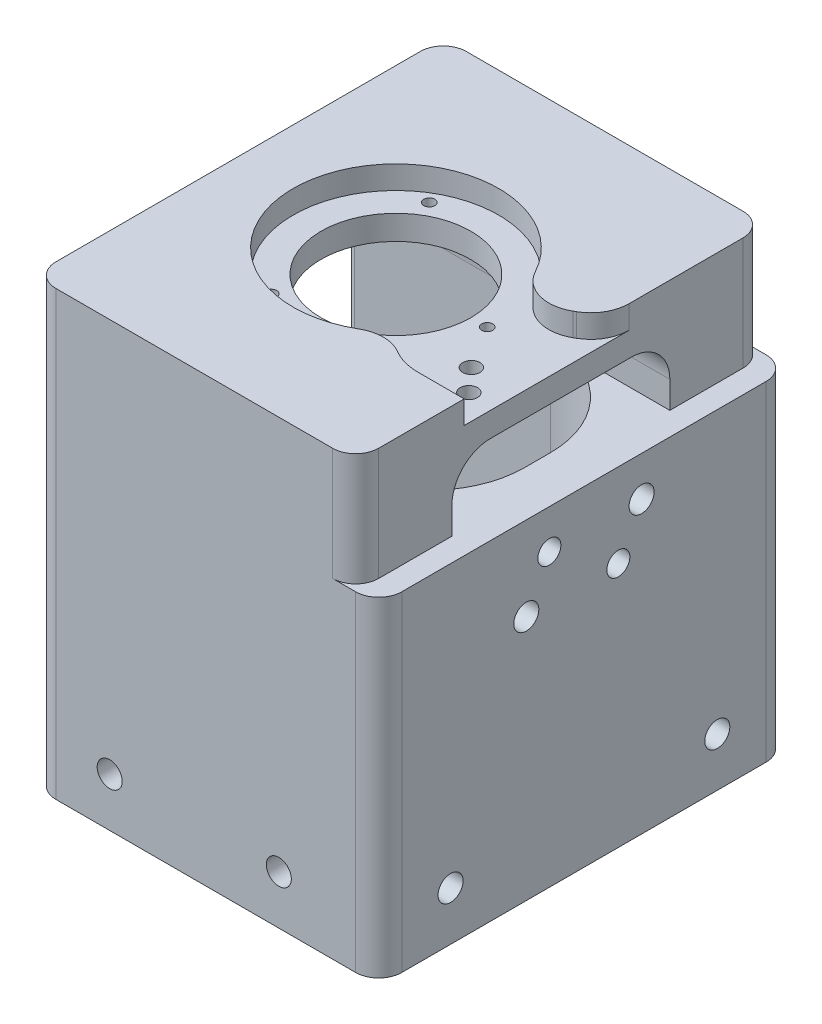
from build123d import *

# Parameters (mm, degrees)
SKETCH1_W                = 90
SKETCH1_H                = 83.75
BOSS_EXTRUDE1_DEPTH      = 106.8
BOSS_EXTRUDE2_DEPTH      = 25.4
CUT_EXTRUDE1_DEPTH       = 163.850552655
CUT_EXTRUDE1_DEPTH_BACK  = 163.850552655
SKETCH3_R                = 3.25755
CUT_EXTRUDE2_DEPTH       = 163.850552655
CUT_EXTRUDE2_DEPTH_BACK  = 163.850552655
SKETCH4_R                = 3.25755
SKETCH5_W                = 56.7
SKETCH5_H                = 77.4
CUT_EXTRUDE3_DEPTH       = 84
FILLET3_R                = 10
CUT_EXTRUDE4_DEPTH       = 178.256769969
CUT_EXTRUDE4_DEPTH_BACK  = 178.256769969
SKETCH6_R                = 1.45
SKETCH6_R_2              = 19.5
CUT_EXTRUDE5_DEPTH       = 163.850552762
CUT_EXTRUDE5_DEPTH_BACK  = 6
SKETCH8_W                = 84
SKETCH8_H                = 106.8
SKETCH8_R                = 26.75
BOSS_EXTRUDE3_DEPTH      = 6
SKETCH9_R                = 2.5
CUT_EXTRUDE6_DEPTH       = 174.418799442
SKETCH10_R               = 3
SKETCH10_R_2             = 3.25755
CUT_EXTRUDE7_DEPTH       = 167.015970671
SKETCH11_W               = 56.7
SKETCH11_H               = 60.4
SKETCH11_R               = 3.25755
SKETCH11_R_2             = 3
BOSS_EXTRUDE4_DEPTH      = 6
FILLET5_R                = 25
SKETCH12_R               = 7
SKETCH12_R_2             = 3.25755
CUT_EXTRUDE8_DEPTH       = 160.828978961
SKETCH13_R               = 2.25
CUT_EXTRUDE9_DEPTH       = 12.35
SKETCH14_R               = 2.25
CUT_EXTRUDE10_DEPTH      = 6
FILLET6_R                = 10
FILLET2_R                = 6
CUT_EXTRUDE11_DEPTH      = 17
CUT_EXTRUDE11_DEPTH_BACK = 3
SKETCH15_R               = 2.25
FILLET8_R                = 2


# Some blends are built 0.0001 mm under size
with BuildPart() as part:
    # Sketch1 → Boss-Extrude1 (new body)
    with BuildSketch(Plane.XY):
        with Locations((45, 41.875)):
            Rectangle(SKETCH1_W, SKETCH1_H)
    extrude(amount=BOSS_EXTRUDE1_DEPTH)

    # Sketch2 → Boss-Extrude2 (add)
    with BuildSketch(Plane.XZ):
        Polygon((0, 106.8), (90, 106.8), (90, 0), (0, 0), (0, 6), (84, 6), (84, 100.8), (0, 100.8), align=None)
    extrude(amount=BOSS_EXTRUDE2_DEPTH)

    # Sketch3 → Cut-Extrude1 (cut, two sides: drawn at the far end of the back side and taken through both)
    with BuildSketch(Plane(origin=(90, 0, 0), x_dir=(0, 0, -1), z_dir=(1, 0, 0)).offset(-CUT_EXTRUDE1_DEPTH_BACK)):
        with Locations((-88.1, -12.7)):
            Circle(SKETCH3_R)
        with Locations((-18.7, -12.7)):
            Circle(SKETCH3_R)
    extrude(amount=CUT_EXTRUDE1_DEPTH + CUT_EXTRUDE1_DEPTH_BACK, mode=Mode.SUBTRACT)

    # Sketch4 → Cut-Extrude2 (cut, two sides: drawn at the far end of the back side and taken through both)
    with BuildSketch(Plane(origin=(0, 0, 0), x_dir=(-1, 0, 0), z_dir=(0, 0, -1)).offset(-CUT_EXTRUDE2_DEPTH_BACK)):
        with Locations((-64, -12.7)):
            Circle(SKETCH4_R)
        with Locations((-20, -12.7)):
            Circle(SKETCH4_R)
    extrude(amount=CUT_EXTRUDE2_DEPTH + CUT_EXTRUDE2_DEPTH_BACK, mode=Mode.SUBTRACT)

    # Sketch5 → Cut-Extrude3 (cut)
    with BuildSketch(Plane.ZY):
        with Locations((53.4, 38.7)):
            Rectangle(SKETCH5_W, SKETCH5_H)
    extrude(amount=-CUT_EXTRUDE3_DEPTH, mode=Mode.SUBTRACT)

    # Fillet3
    fillet3_edges = [part.edges().sort_by_distance(p)[0] for p in [
        (42, 77.4, 81.75),
        (42, 77.4, 25.05),
    ]]
    fillet(fillet3_edges, radius=FILLET3_R)

    # Sketch6 → Cut-Extrude4 (cut, two sides: drawn at the far end of the back side and taken through both)
    with BuildSketch(Plane(origin=(0, 83.75, 0), x_dir=(1, 0, 0), z_dir=(0, 1, 0)).offset(-CUT_EXTRUDE4_DEPTH_BACK)):
        with Locations(Location((29.205, -32.83189666, 0), (0, 0, 180))):
            Circle(SKETCH6_R)
        with Locations(Location((41.08, -53.4, 0), (0, 0, 250.22451894))):
            Circle(SKETCH6_R_2)
        with Locations(Location((64.83, -53.4, 0), (0, 0, 180))):
            Circle(SKETCH6_R)
        with Locations(Location((29.205, -73.96810334, 0), (0, 0, 180))):
            Circle(SKETCH6_R)
    extrude(amount=CUT_EXTRUDE4_DEPTH + CUT_EXTRUDE4_DEPTH_BACK, mode=Mode.SUBTRACT)

    # Sketch7 → Cut-Extrude5 (cut, two sides: drawn at the far end of the back side and taken through both)
    with BuildSketch(Plane(origin=(90, 0, 0), x_dir=(0, 0, -1), z_dir=(1, 0, 0)).offset(-CUT_EXTRUDE5_DEPTH_BACK)):
        Polygon((-106.8, 77.4), (-71.75, 77.4), (-35.05, 77.4), (0, 77.4), (0, 83.75), (-106.8, 83.75), align=None)
        Polygon((-35.05, 77.4), (-71.75, 77.4), (-106.8, 77.4), (-106.8, 60.4), (0, 60.4), (0, 77.4), align=None)
    extrude(amount=CUT_EXTRUDE5_DEPTH + CUT_EXTRUDE5_DEPTH_BACK, mode=Mode.SUBTRACT)

    # Sketch8 → Boss-Extrude3 (add)
    with BuildSketch(Plane(origin=(0, 83.75, 0), x_dir=(1, 0, 0), z_dir=(0, 1, 0))):
        with Locations((42, -53.4)):
            Rectangle(SKETCH8_W, SKETCH8_H)
        with Locations(Location((41.08, -53.4, 0), (0, 0, 180))):
            Circle(SKETCH8_R, mode=Mode.SUBTRACT)
    extrude(amount=BOSS_EXTRUDE3_DEPTH)

    # Sketch9 → Cut-Extrude6 (cut, through all)
    with BuildSketch(Plane.XZ.offset(-77.4)):
        with Locations((29.205, 32.83189666)):
            Circle(SKETCH9_R)
        with Locations((29.205, 73.96810334)):
            Circle(SKETCH9_R)
        with Locations((64.83, 53.4)):
            Circle(SKETCH9_R)
    extrude(amount=CUT_EXTRUDE6_DEPTH, mode=Mode.SUBTRACT)

    # Sketch10 → Cut-Extrude7 (cut, through all)
    with BuildSketch(Plane(origin=(90, 0, 0), x_dir=(0, 0, -1), z_dir=(1, 0, 0))):
        with Locations(Location((-62.4, 50.2, 0), (0, 0, 90))):
            Circle(SKETCH10_R)
        with Locations(Location((-68.4, 38.6, 0), (0, 0, 90))):
            Circle(SKETCH10_R_2)
        with Locations(Location((-38.4, 50.07, 0), (0, 0, 90))):
            Circle(SKETCH10_R_2)
        with Locations(Location((-44.45, 38.6, 0), (0, 0, 90))):
            Circle(SKETCH10_R)
    extrude(amount=-CUT_EXTRUDE7_DEPTH, mode=Mode.SUBTRACT)

    # Sketch11 → Boss-Extrude4 (add)
    with BuildSketch(Plane.ZY.offset(-84)):
        with Locations((53.4, 30.2)):
            Rectangle(SKETCH11_W, SKETCH11_H)
        with Locations(Location((68.4, 38.6, 0), (0, 0, 90))):
            Circle(SKETCH11_R, mode=Mode.SUBTRACT)
        with Locations(Location((62.4, 50.2, 0), (0, 0, 90))):
            Circle(SKETCH11_R_2, mode=Mode.SUBTRACT)
        with Locations(Location((44.45, 38.6, 0), (0, 0, 90))):
            Circle(SKETCH11_R_2, mode=Mode.SUBTRACT)
        with Locations(Location((38.4, 50.07, 0), (0, 0, 90))):
            Circle(SKETCH11_R, mode=Mode.SUBTRACT)
    extrude(amount=BOSS_EXTRUDE4_DEPTH)

    # Fillet5
    # the kernel refuses this fillet: 25 mm, written as the material it adds along each edge
    with BuildSketch(Plane(origin=(78, 60.4, 25.05), x_dir=(0, 0, 1), z_dir=(0, -1, 0))) as fillet5_piece_1_section:
        with BuildLine():
            CenterArc((FILLET5_R, FILLET5_R), FILLET5_R, 180, 90)
            Line((0, FILLET5_R), (0, 0))
            Line((0, 0), (FILLET5_R, 0))
        make_face()
    fillet5_piece_1 = extrude(amount=60.4, mode=Mode.PRIVATE)
    fillet5_piece_1 = fillet5_piece_1 - Plane(origin=(72.268071364, 50.07, 38.4), x_dir=(0, 1, 0), z_dir=(1, 0, 0)) * Cylinder(3.25755, 221, mode=Mode.PRIVATE)
    fillet5_piece_1 = fillet5_piece_1 - Plane(origin=(72.268071364, 38.6, 44.45), x_dir=(0, 1, 0), z_dir=(1, 0, 0)) * Cylinder(3, 221, mode=Mode.PRIVATE)
    add(fillet5_piece_1)
    with BuildSketch(Plane(origin=(78, 0, 81.75), x_dir=(0, 0, -1), z_dir=(0, 1, 0))) as fillet5_piece_2_section:
        with BuildLine():
            CenterArc((FILLET5_R, FILLET5_R), FILLET5_R, 180, 90)
            Line((0, FILLET5_R), (0, 0))
            Line((0, 0), (FILLET5_R, 0))
        make_face()
    fillet5_piece_2 = extrude(amount=60.4, mode=Mode.PRIVATE)
    fillet5_piece_2 = fillet5_piece_2 - Plane(origin=(72.267907092, 50.2, 62.4), x_dir=(0, 1, 0), z_dir=(1, 0, 0)) * Cylinder(3, 221, mode=Mode.PRIVATE)
    fillet5_piece_2 = fillet5_piece_2 - Plane(origin=(72.267907092, 38.6, 68.4), x_dir=(0, 1, 0), z_dir=(1, 0, 0)) * Cylinder(3.25755, 221, mode=Mode.PRIVATE)
    add(fillet5_piece_2)

    # Sketch12 → Cut-Extrude8 (cut, through all)
    # profile 1 of 2: a face of its own
    with BuildSketch(Plane.ZY.offset(-78)):
        with Locations(Location((38.4, 50.07, 0), (0, 0, 180))):
            Circle(SKETCH12_R)
        with Locations(Location((38.4, 50.07, 0), (0, 0, 90))):
            Circle(SKETCH12_R_2, mode=Mode.SUBTRACT)
    # profile 2 of 2: a face of its own
    with BuildSketch(Plane.ZY.offset(-78)):
        with Locations(Location((68.4, 38.6, 0), (0, 0, 180))):
            Circle(SKETCH12_R)
        with Locations(Location((68.4, 38.6, 0), (0, 0, 90))):
            Circle(SKETCH12_R_2, mode=Mode.SUBTRACT)
    extrude(amount=CUT_EXTRUDE8_DEPTH, mode=Mode.SUBTRACT)

    # Sketch13 → Cut-Extrude9 (cut)
    with BuildSketch(Plane(origin=(0, 89.75, 0), x_dir=(1, 0, 0), z_dir=(0, 1, 0))):
        with Locations(Location((71.87, -64.56, 0), (0, 0, 180))):
            Circle(SKETCH13_R)
        with Locations(Location((77.19, -70.54, 0), (0, 0, 180))):
            Circle(SKETCH13_R)
    extrude(amount=-CUT_EXTRUDE9_DEPTH, mode=Mode.SUBTRACT)

    # Sketch14 → Cut-Extrude10 (cut)
    with BuildSketch(Plane(origin=(0, 89.75, 0), x_dir=(1, 0, 0), z_dir=(0, 1, 0))):
        with BuildLine():
            Line((71.87, -78.56), (84, -78.56))
            Line((84, -78.56), (84, -41.390933697))
            Line((84, -41.390933697), (67.703327624, -50.799821881))
            ThreePointArc((67.703327624, -50.799821881), (66.294010496, -62.333989855), (60.126930735, -72.182356869))
            ThreePointArc((60.126930735, -72.182356869), (65.188420702, -76.862702877), (71.87, -78.56))
        make_face()
        with Locations(Location((71.87, -64.56, 0), (0, 0, 180))):
            Circle(SKETCH14_R, mode=Mode.SUBTRACT)
        with Locations(Location((77.19, -70.54, 0), (0, 0, 180))):
            Circle(SKETCH14_R, mode=Mode.SUBTRACT)
    extrude(amount=-CUT_EXTRUDE10_DEPTH, mode=Mode.SUBTRACT)

    # Fillet6
    # the kernel refuses this fillet: 10 mm, written as the material it takes off along each edge
    with BuildSketch(Plane(origin=(60.126930735, 107.447191058, 72.182356869), x_dir=(-0.790183892802771, 0, 0.612869819419311), z_dir=(0, -1, 0))) as fillet6_piece_1:
        with BuildLine():
            CenterArc((8.402030895, -9.912076586), FILLET6_R, 97.603413712, 61.044976662)
            ThreePointArc((-0.911605588, -6.271173474), (-0.09630874, -3.187844387), (0, 0))
            ThreePointArc((0, 0), (3.539438212, -0.235195133), (7.078876423, 0))
        make_face()
    extrude(amount=23.697191058, mode=Mode.SUBTRACT)
    with BuildSketch(Plane(origin=(67.703327624, 120.695367862, 50.799821881), x_dir=(0.8660254037844412, 0, -0.49999999999999584), z_dir=(0, -1, 0))) as fillet6_piece_2:
        with BuildLine():
            CenterArc((12.378147145, -10), FILLET6_R, 90, 91.652598108)
            ThreePointArc((2.38230653, -10.288392791), (1.703915865, -5.025464761), (0, 0))
            Line((0, 0), (12.378147145, 0))
        make_face()
    extrude(amount=36.945367862, mode=Mode.SUBTRACT)
    with BuildSketch(Plane(origin=(84, 104.18375673, 41.390933697), x_dir=(0, 0, -1), z_dir=(0, -1, 0))) as fillet6_piece_3:
        with BuildLine():
            CenterArc((FILLET6_R * 0.57735026919, -FILLET6_R), FILLET6_R, 90, 60)
            Line((-FILLET6_R * 0.288675134595, -FILLET6_R * 0.5), (0, 0))
            Line((0, 0), (FILLET6_R * 0.57735026919, 0))
        make_face()
    extrude(amount=20.43375673, mode=Mode.SUBTRACT)

    # Fillet2
    fillet2_edges = [part.edges().sort_by_distance(p)[0] for p in [
        (84, 75.075, 106.8),
        (84, 75.075, 0),
        (0, 32.175, 106.8),
        (0, 32.175, 0),
        (90, 17.5, 0),
        (90, 17.5, 106.8),
    ]]
    fillet(fillet2_edges, radius=FILLET2_R - 0.0001)  # a hair under: the kernel refuses the full size

    # Sketch15 → Cut-Extrude11 (cut, two sides: drawn at the far end of the back side and taken through both)
    # profile 1 of 2: a face of its own
    with BuildSketch(Plane.XZ.offset(-77.4).offset(-CUT_EXTRUDE11_DEPTH_BACK)):
        with BuildLine():
            Line((72.243435089, 71.75), (68.507899126, 67.551032884))
            ThreePointArc((68.507899126, 67.551032884), (68.878967116, 61.197899126), (75.232100874, 61.568967116))
            Line((75.232100874, 61.568967116), (80.552100874, 67.548967116))
            ThreePointArc((80.552100874, 67.548967116), (81.574142113, 69.525456784), (81.524270411, 71.75))
            Line((81.524270411, 71.75), (79.086944912, 71.75))
            ThreePointArc((79.086944912, 71.75), (77.19, 68.29), (75.293055088, 71.75))
            Line((75.293055088, 71.75), (72.243435089, 71.75))
        make_face()
        with Locations(Location((71.87, 64.56, 0), (0, 0, 180))):
            Circle(SKETCH15_R, mode=Mode.SUBTRACT)
    # profile 2 of 2: a face of its own
    with BuildSketch(Plane.XZ.offset(-77.4).offset(-CUT_EXTRUDE11_DEPTH_BACK)):
        with BuildLine():
            ThreePointArc((79.086944912, 71.75), (77.19, 72.79), (75.293055088, 71.75))
            Line((75.293055088, 71.75), (79.086944912, 71.75))
        make_face()
    extrude(amount=CUT_EXTRUDE11_DEPTH + CUT_EXTRUDE11_DEPTH_BACK, mode=Mode.SUBTRACT)

    # Fillet8
    fillet8_edges = [part.edges().sort_by_distance(p)[0] for p in [
        (0, 33.7, 81.75),
        (0, 77.4, 53.4),
        (0, 33.7, 25.05),
        (0, 74.471067812, 78.821067812),
        (0, 74.471067812, 27.978932188),
    ]]
    fillet(fillet8_edges, radius=FILLET8_R)


solid = part.part
